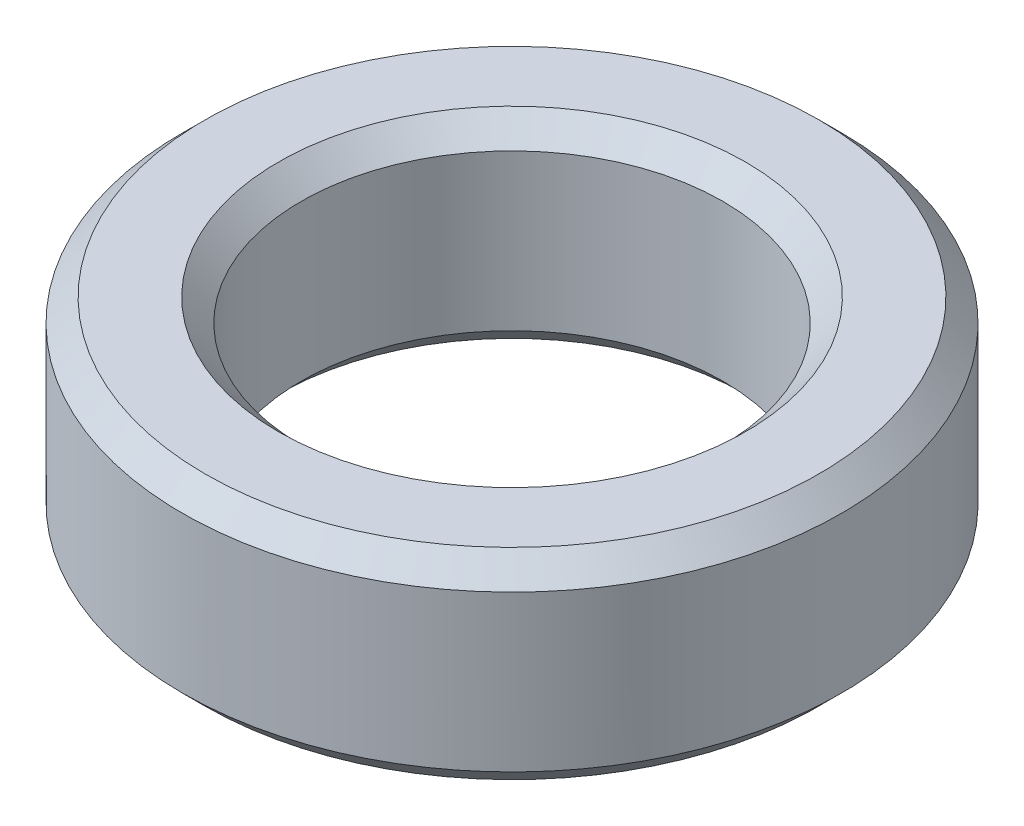
from build123d import *

# Parameters (mm, degrees)
SKETCH1_R           = 22.5
BOSS_EXTRUDE1_DEPTH = 13.732186371
SKETCH2_R           = 14.399370576
CUT_EXTRUDE1_DEPTH  = 35.656499283
CHAMFER1_SIZE       = 1.550056615


with BuildPart() as part:
    # Sketch1 → Boss-Extrude1 (new body)
    with BuildSketch(Plane(origin=(0, 0, 0), x_dir=(1, 0, 0), z_dir=(0, 1, 0))):
        Circle(SKETCH1_R)
    extrude(amount=BOSS_EXTRUDE1_DEPTH)

    # Sketch2 → Cut-Extrude1 (cut, through all)
    with BuildSketch(Plane(origin=(0, 0, 0), x_dir=(1, 0, 0), z_dir=(0, 1, 0))):
        Circle(SKETCH2_R)
    extrude(amount=CUT_EXTRUDE1_DEPTH, mode=Mode.SUBTRACT)

    # Chamfer1
    chamfer1_edges = [part.edges().sort_by_distance(p)[0] for p in [
        (-14.399370576, 13.732186371, 0),
        (-14.399370576, 0, 0),
        (-22.5, 0, 0),
        (-22.5, 13.732186371, 0),
    ]]
    chamfer(chamfer1_edges, length=CHAMFER1_SIZE)


solid = part.part
